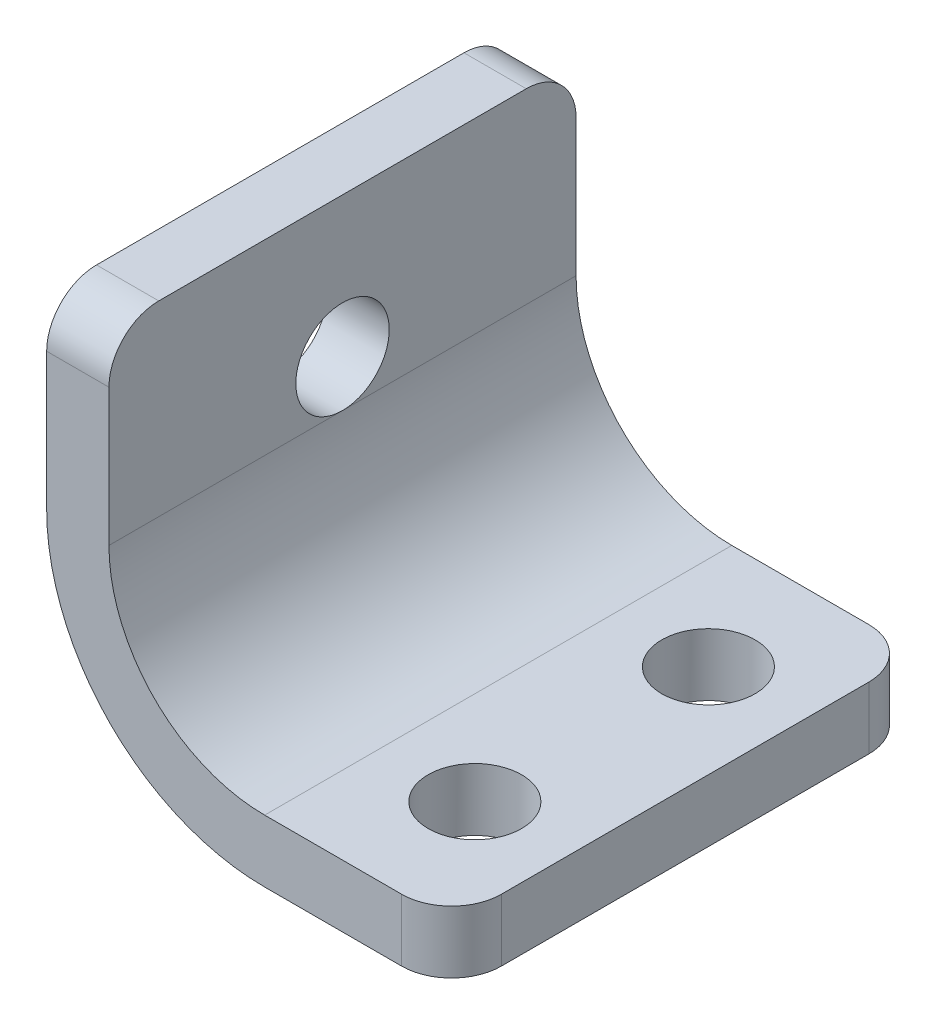
from build123d import *

# Parameters (mm, degrees)
BOSS_EXTRUDE1_DEPTH = 23.8125
FILLET1_R           = 2.54
CUT_EXTRUDE2_REACH  = 36.306
SKETCH3_R           = 2.38125
CUT_EXTRUDE3_REACH  = 39.134


with BuildPart() as part:
    # Sketch1 → Boss-Extrude1 (new body)
    with BuildSketch(Plane.XY):
        with BuildLine():
            Line((0, 22.515786623), (0, 12.990786623))
            ThreePointArc((0, 12.990786623), (2.324839924, 7.378126548), (7.9375, 5.053286623))
            Line((7.9375, 5.053286623), (17.4625, 5.053286623))
            Line((17.4625, 5.053286623), (17.4625, 1.878286623))
            Line((17.4625, 1.878286623), (7.9375, 1.878286623))
            ThreePointArc((7.9375, 1.878286623), (0.079775894, 5.133062518), (-3.175, 12.990786623))
            Line((-3.175, 12.990786623), (-3.175, 22.515786623))
            Line((-3.175, 22.515786623), (0, 22.515786623))
        make_face()
    extrude(amount=BOSS_EXTRUDE1_DEPTH)

    # Fillet1
    fillet1_edges = [part.edges().sort_by_distance(p)[0] for p in [
        (17.4625, 3.465786623, 23.8125),
        (17.4625, 3.465786623, 0),
        (-1.5875, 22.515786623, 23.8125),
        (-1.5875, 22.515786623, 0),
    ]]
    fillet(fillet1_edges, radius=FILLET1_R)

    # Sketch3 → Cut-Extrude2 (cut, up to next)
    with BuildSketch(Plane(origin=(0, 5.053286623, 0), x_dir=(1, 0, 0), z_dir=(0, 1, 0)), mode=Mode.PRIVATE) as cut_extrude2_sk1:
        with Locations((12.7, -17.859375)):
            Circle(SKETCH3_R)
    cut_extrude2_tool1 = extrude(cut_extrude2_sk1.sketch, amount=-CUT_EXTRUDE2_REACH, mode=Mode.PRIVATE) & part.part
    # Sketch3 → Cut-Extrude2 (cut, up to next)
    with BuildSketch(Plane(origin=(0, 5.053286623, 0), x_dir=(1, 0, 0), z_dir=(0, 1, 0)), mode=Mode.PRIVATE) as cut_extrude2_sk2:
        with Locations((12.7, -5.953125)):
            Circle(SKETCH3_R)
    cut_extrude2_tool2 = extrude(cut_extrude2_sk2.sketch, amount=-CUT_EXTRUDE2_REACH, mode=Mode.PRIVATE) & part.part
    add(cut_extrude2_tool1.solids().sort_by_distance((12.7, 5.053287, 17.859375))[0], mode=Mode.SUBTRACT)
    add(cut_extrude2_tool2.solids().sort_by_distance((12.7, 5.053287, 5.953125))[0], mode=Mode.SUBTRACT)

    # Sketch5 → Cut-Extrude3 (cut, up to next)
    with BuildSketch(Plane(origin=(0, 0, 0), x_dir=(0, 0, -1), z_dir=(1, 0, 0)), mode=Mode.PRIVATE) as cut_extrude3_sk1:
        with BuildLine():
            ThreePointArc((-9.525, 15.372036623), (-13.590048023, 17.055834646), (-11.90625, 12.990786623))
            ThreePointArc((-11.90625, 12.990786623), (-10.222451977, 13.688238601), (-9.525, 15.372036623))
        make_face()
    cut_extrude3_tool1 = extrude(cut_extrude3_sk1.sketch, amount=-CUT_EXTRUDE3_REACH, mode=Mode.PRIVATE) & part.part
    add(cut_extrude3_tool1.solids().sort_by_distance((0, 15.372037, 11.90625))[0], mode=Mode.SUBTRACT)


solid = part.part
